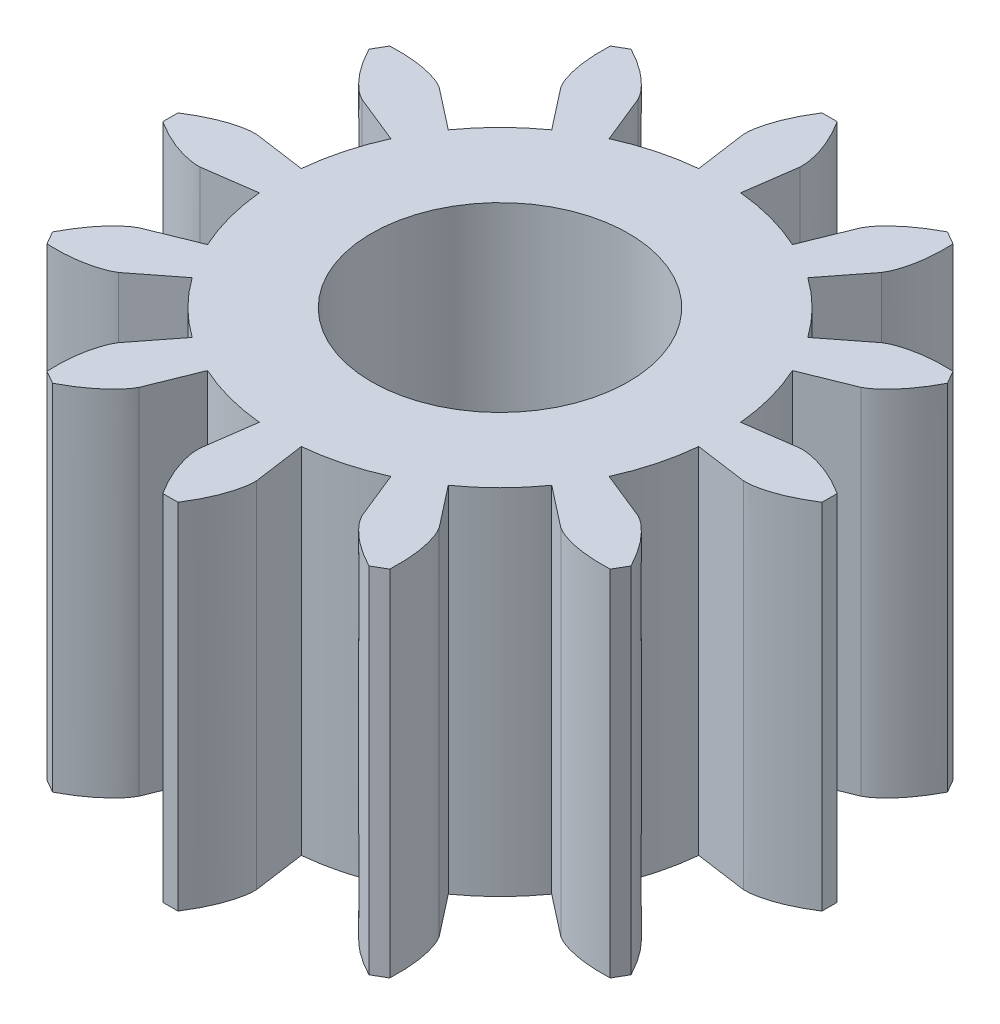
from build123d import *

# Parameters (mm, degrees)
BOSS_EXTRUDE1_DEPTH     = 5
BOSS_EXTRUDE2_DEPTH     = 2.3
CUT_EXTRUDE1_DEPTH      = 13.294307967
CUT_EXTRUDE1_DEPTH_BACK = 13.294307967
SKETCH2_R               = 2.65


with BuildPart() as part:
    # Sketch1 → Boss-Extrude1 (new body)
    with BuildSketch(Plane.XZ.offset(5)):
        with BuildLine():
            Line((3.744124802, -2.923017186), (4.444201828, -3.469563385))
            add(Edge.make_bspline(
                [(4.444201828, -3.469563385), (4.960450288, -3.799470899), (5.92556066, -3.726624593)],
                knots=[3.673021655, 3.673021655, 3.673021655, 4.715634663, 4.715634663, 4.715634663], degree=2, weights=[1, 0.867169263, 1]))
            Line((5.92556066, -3.726624593), (6.190131898, -3.268373767))
            add(Edge.make_bspline(
                [(6.190131898, -3.268373767), (5.77062665, -2.395142555), (5.226830946, -2.11400999)],
                knots=[1.547057367, 1.547057367, 1.547057367, 2.608226651, 2.608226651, 2.608226651], degree=2, weights=[1, 0.862511367, 1]))
            Line((5.226830946, -2.11400999), (4.40346954, -1.7809986))
            ThreePointArc((4.40346954, -1.7809986), (4.588147675, -1.229390464), (4.704015786, -0.659344738))
            Line((4.704015786, -0.659344738), (5.583573376, -0.782629118))
            add(Edge.make_bspline(
                [(5.583573376, -0.782629118), (6.195611413, -0.810213176), (6.99499836, -0.264571238)],
                knots=[3.673021655, 3.673021655, 3.673021655, 4.715634663, 4.715634663, 4.715634663], degree=2, weights=[1, 0.867169263, 1]))
            Line((6.99499836, -0.264571238), (6.99499836, 0.264571238))
            add(Edge.make_bspline(
                [(6.99499836, 0.264571238), (6.195080552, 0.811059027), (5.583573376, 0.782629118)],
                knots=[1.547057367, 1.547057367, 1.547057367, 2.608226651, 2.608226651, 2.608226651], degree=2, weights=[1, 0.862511367, 1]))
            Line((5.583573376, 0.782629118), (4.704015786, 0.659344738))
            ThreePointArc((4.704015786, 0.659344738), (4.588147675, 1.229390464), (4.40346954, 1.7809986))
            Line((4.40346954, 1.7809986), (5.226830946, 2.11400999))
            add(Edge.make_bspline(
                [(5.226830946, 2.11400999), (5.770663464, 2.396140514), (6.190131898, 3.268373767)],
                knots=[0.531429001, 0.531429001, 0.531429001, 1.57404201, 1.57404201, 1.57404201], degree=2, weights=[1, 0.867169263, 1]))
            Line((6.190131898, 3.268373767), (5.92556066, 3.726624593))
            add(Edge.make_bspline(
                [(5.92556066, 3.726624593), (4.959567623, 3.799937997), (4.444201828, 3.469563385)],
                knots=[1.547057367, 1.547057367, 1.547057367, 2.608226651, 2.608226651, 2.608226651], degree=2, weights=[1, 0.862511367, 1]))
            Line((4.444201828, 3.469563385), (3.744124802, 2.923017186))
            ThreePointArc((3.744124802, 2.923017186), (3.358757211, 3.358757211), (2.923017186, 3.744124802))
            Line((2.923017186, 3.744124802), (3.469563385, 4.444201828))
            add(Edge.make_bspline(
                [(3.469563385, 4.444201828), (3.799470899, 4.960450288), (3.726624593, 5.92556066)],
                knots=[0.531429001, 0.531429001, 0.531429001, 1.57404201, 1.57404201, 1.57404201], degree=2, weights=[1, 0.867169263, 1]))
            Line((3.726624593, 5.92556066), (3.268373767, 6.190131898))
            add(Edge.make_bspline(
                [(3.268373767, 6.190131898), (2.395142555, 5.77062665), (2.11400999, 5.226830946)],
                knots=[1.547057367, 1.547057367, 1.547057367, 2.608226651, 2.608226651, 2.608226651], degree=2, weights=[1, 0.862511367, 1]))
            Line((2.11400999, 5.226830946), (1.7809986, 4.40346954))
            ThreePointArc((1.7809986, 4.40346954), (1.229390464, 4.588147675), (0.659344738, 4.704015786))
            Line((0.659344738, 4.704015786), (0.782629118, 5.583573376))
            add(Edge.make_bspline(
                [(0.782629118, 5.583573376), (0.810213176, 6.195611413), (0.264571238, 6.99499836)],
                knots=[0.531429001, 0.531429001, 0.531429001, 1.57404201, 1.57404201, 1.57404201], degree=2, weights=[1, 0.867169263, 1]))
            Line((0.264571238, 6.99499836), (-0.264571238, 6.99499836))
            add(Edge.make_bspline(
                [(-0.264571238, 6.99499836), (-0.811059027, 6.195080552), (-0.782629118, 5.583573376)],
                knots=[4.688650021, 4.688650021, 4.688650021, 5.749819305, 5.749819305, 5.749819305], degree=2, weights=[1, 0.862511367, 1]))
            Line((-0.782629118, 5.583573376), (-0.659344738, 4.704015786))
            ThreePointArc((-0.659344738, 4.704015786), (-1.229390464, 4.588147675), (-1.7809986, 4.40346954))
            Line((-1.7809986, 4.40346954), (-2.11400999, 5.226830946))
            add(Edge.make_bspline(
                [(-2.11400999, 5.226830946), (-2.396140514, 5.770663464), (-3.268373767, 6.190131898)],
                knots=[0.531429001, 0.531429001, 0.531429001, 1.57404201, 1.57404201, 1.57404201], degree=2, weights=[1, 0.867169263, 1]))
            Line((-3.268373767, 6.190131898), (-3.726624593, 5.92556066))
            add(Edge.make_bspline(
                [(-3.726624593, 5.92556066), (-3.799937997, 4.959567623), (-3.469563385, 4.444201828)],
                knots=[4.688650021, 4.688650021, 4.688650021, 5.749819305, 5.749819305, 5.749819305], degree=2, weights=[1, 0.862511367, 1]))
            Line((-3.469563385, 4.444201828), (-2.923017186, 3.744124802))
            ThreePointArc((-2.923017186, 3.744124802), (-3.358757211, 3.358757211), (-3.744124802, 2.923017186))
            Line((-3.744124802, 2.923017186), (-4.444201828, 3.469563385))
            add(Edge.make_bspline(
                [(-4.444201828, 3.469563385), (-4.960450288, 3.799470899), (-5.92556066, 3.726624593)],
                knots=[0.531429001, 0.531429001, 0.531429001, 1.57404201, 1.57404201, 1.57404201], degree=2, weights=[1, 0.867169263, 1]))
            Line((-5.92556066, 3.726624593), (-6.190131898, 3.268373767))
            add(Edge.make_bspline(
                [(-6.190131898, 3.268373767), (-5.77062665, 2.395142555), (-5.226830946, 2.11400999)],
                knots=[4.688650021, 4.688650021, 4.688650021, 5.749819305, 5.749819305, 5.749819305], degree=2, weights=[1, 0.862511367, 1]))
            Line((-5.226830946, 2.11400999), (-4.40346954, 1.7809986))
            ThreePointArc((-4.40346954, 1.7809986), (-4.588147675, 1.229390464), (-4.704015786, 0.659344738))
            Line((-4.704015786, 0.659344738), (-5.583573376, 0.782629118))
            add(Edge.make_bspline(
                [(-5.583573376, 0.782629118), (-6.195611413, 0.810213176), (-6.99499836, 0.264571238)],
                knots=[0.531429001, 0.531429001, 0.531429001, 1.57404201, 1.57404201, 1.57404201], degree=2, weights=[1, 0.867169263, 1]))
            Line((-6.99499836, 0.264571238), (-6.99499836, -0.264571238))
            add(Edge.make_bspline(
                [(-6.99499836, -0.264571238), (-6.195080552, -0.811059027), (-5.583573376, -0.782629118)],
                knots=[4.688650021, 4.688650021, 4.688650021, 5.749819305, 5.749819305, 5.749819305], degree=2, weights=[1, 0.862511367, 1]))
            Line((-5.583573376, -0.782629118), (-4.704015786, -0.659344738))
            ThreePointArc((-4.704015786, -0.659344738), (-4.588147675, -1.229390464), (-4.40346954, -1.7809986))
            Line((-4.40346954, -1.7809986), (-5.226830946, -2.11400999))
            add(Edge.make_bspline(
                [(-5.226830946, -2.11400999), (-5.770663464, -2.396140514), (-6.190131898, -3.268373767)],
                knots=[3.673021655, 3.673021655, 3.673021655, 4.715634663, 4.715634663, 4.715634663], degree=2, weights=[1, 0.867169263, 1]))
            Line((-6.190131898, -3.268373767), (-5.92556066, -3.726624593))
            add(Edge.make_bspline(
                [(-5.92556066, -3.726624593), (-4.959567623, -3.799937997), (-4.444201828, -3.469563385)],
                knots=[4.688650021, 4.688650021, 4.688650021, 5.749819305, 5.749819305, 5.749819305], degree=2, weights=[1, 0.862511367, 1]))
            Line((-4.444201828, -3.469563385), (-3.744124802, -2.923017186))
            ThreePointArc((-3.744124802, -2.923017186), (-3.358757211, -3.358757211), (-2.923017186, -3.744124802))
            Line((-2.923017186, -3.744124802), (-3.469563385, -4.444201828))
            add(Edge.make_bspline(
                [(-3.469563385, -4.444201828), (-3.799470899, -4.960450288), (-3.726624593, -5.92556066)],
                knots=[3.673021655, 3.673021655, 3.673021655, 4.715634663, 4.715634663, 4.715634663], degree=2, weights=[1, 0.867169263, 1]))
            Line((-3.726624593, -5.92556066), (-3.268373767, -6.190131898))
            add(Edge.make_bspline(
                [(-3.268373767, -6.190131898), (-2.395142555, -5.77062665), (-2.11400999, -5.226830946)],
                knots=[1.547057367, 1.547057367, 1.547057367, 2.608226651, 2.608226651, 2.608226651], degree=2, weights=[1, 0.862511367, 1]))
            Line((-2.11400999, -5.226830946), (-1.7809986, -4.40346954))
            ThreePointArc((-1.7809986, -4.40346954), (-1.229390464, -4.588147675), (-0.659344738, -4.704015786))
            Line((-0.659344738, -4.704015786), (-0.782629118, -5.583573376))
            add(Edge.make_bspline(
                [(-0.782629118, -5.583573376), (-0.810213176, -6.195611413), (-0.264571238, -6.99499836)],
                knots=[3.673021655, 3.673021655, 3.673021655, 4.715634663, 4.715634663, 4.715634663], degree=2, weights=[1, 0.867169263, 1]))
            Line((-0.264571238, -6.99499836), (0.264571238, -6.99499836))
            add(Edge.make_bspline(
                [(0.264571238, -6.99499836), (0.811059027, -6.195080552), (0.782629118, -5.583573376)],
                knots=[1.547057367, 1.547057367, 1.547057367, 2.608226651, 2.608226651, 2.608226651], degree=2, weights=[1, 0.862511367, 1]))
            Line((0.782629118, -5.583573376), (0.659344738, -4.704015786))
            ThreePointArc((0.659344738, -4.704015786), (1.229390464, -4.588147675), (1.7809986, -4.40346954))
            Line((1.7809986, -4.40346954), (2.11400999, -5.226830946))
            add(Edge.make_bspline(
                [(2.11400999, -5.226830946), (2.396140514, -5.770663464), (3.268373767, -6.190131898)],
                knots=[3.673021655, 3.673021655, 3.673021655, 4.715634663, 4.715634663, 4.715634663], degree=2, weights=[1, 0.867169263, 1]))
            Line((3.268373767, -6.190131898), (3.726624593, -5.92556066))
            add(Edge.make_bspline(
                [(3.726624593, -5.92556066), (3.799937997, -4.959567623), (3.469563385, -4.444201828)],
                knots=[1.547057367, 1.547057367, 1.547057367, 2.608226651, 2.608226651, 2.608226651], degree=2, weights=[1, 0.862511367, 1]))
            Line((3.469563385, -4.444201828), (2.923017186, -3.744124802))
            ThreePointArc((2.923017186, -3.744124802), (3.358757211, -3.358757211), (3.744124802, -2.923017186))
        make_face()
    extrude(amount=-BOSS_EXTRUDE1_DEPTH)

    # Sketch3 → Boss-Extrude2 (add)
    with BuildSketch(Plane(origin=(0, 0, 0), x_dir=(1, 0, 0), z_dir=(0, 1, 0))):
        with BuildLine():
            Line((2.923017186, 3.744124802), (3.469563385, 4.444201828))
            add(Edge.make_bspline(
                [(3.469563385, 4.444201828), (3.799937997, 4.959567623), (3.726624593, 5.92556066)],
                knots=[3.674958656, 3.674958656, 3.674958656, 4.73612794, 4.73612794, 4.73612794], degree=2, weights=[1, 0.862511367, 1]))
            Line((3.726624593, 5.92556066), (3.268373767, 6.190131898))
            add(Edge.make_bspline(
                [(3.268373767, 6.190131898), (2.396140514, 5.770663464), (2.11400999, 5.226830946)],
                knots=[1.567550644, 1.567550644, 1.567550644, 2.610163652, 2.610163652, 2.610163652], degree=2, weights=[1, 0.867169263, 1]))
            Line((2.11400999, 5.226830946), (1.7809986, 4.40346954))
            ThreePointArc((1.7809986, 4.40346954), (1.229390464, 4.588147675), (0.659344738, 4.704015786))
            Line((0.659344738, 4.704015786), (0.782629118, 5.583573376))
            add(Edge.make_bspline(
                [(0.782629118, 5.583573376), (0.811059027, 6.195080552), (0.264571238, 6.99499836)],
                knots=[3.674958656, 3.674958656, 3.674958656, 4.73612794, 4.73612794, 4.73612794], degree=2, weights=[1, 0.862511367, 1]))
            Line((0.264571238, 6.99499836), (-0.264571238, 6.99499836))
            add(Edge.make_bspline(
                [(-0.264571238, 6.99499836), (-0.810213176, 6.195611413), (-0.782629118, 5.583573376)],
                knots=[1.567550644, 1.567550644, 1.567550644, 2.610163652, 2.610163652, 2.610163652], degree=2, weights=[1, 0.867169263, 1]))
            Line((-0.782629118, 5.583573376), (-0.659344738, 4.704015786))
            ThreePointArc((-0.659344738, 4.704015786), (-1.229390464, 4.588147675), (-1.7809986, 4.40346954))
            Line((-1.7809986, 4.40346954), (-2.11400999, 5.226830946))
            add(Edge.make_bspline(
                [(-2.11400999, 5.226830946), (-2.395142555, 5.77062665), (-3.268373767, 6.190131898)],
                knots=[0.533366002, 0.533366002, 0.533366002, 1.594535286, 1.594535286, 1.594535286], degree=2, weights=[1, 0.862511367, 1]))
            Line((-3.268373767, 6.190131898), (-3.726624593, 5.92556066))
            add(Edge.make_bspline(
                [(-3.726624593, 5.92556066), (-3.799470899, 4.960450288), (-3.469563385, 4.444201828)],
                knots=[1.567550644, 1.567550644, 1.567550644, 2.610163652, 2.610163652, 2.610163652], degree=2, weights=[1, 0.867169263, 1]))
            Line((-3.469563385, 4.444201828), (-2.923017186, 3.744124802))
            ThreePointArc((-2.923017186, 3.744124802), (-3.358757211, 3.358757211), (-3.744124802, 2.923017186))
            Line((-3.744124802, 2.923017186), (-4.444201828, 3.469563385))
            add(Edge.make_bspline(
                [(-4.444201828, 3.469563385), (-4.959567623, 3.799937997), (-5.92556066, 3.726624593)],
                knots=[0.533366002, 0.533366002, 0.533366002, 1.594535286, 1.594535286, 1.594535286], degree=2, weights=[1, 0.862511367, 1]))
            Line((-5.92556066, 3.726624593), (-6.190131898, 3.268373767))
            add(Edge.make_bspline(
                [(-6.190131898, 3.268373767), (-5.770663464, 2.396140514), (-5.226830946, 2.11400999)],
                knots=[1.567550644, 1.567550644, 1.567550644, 2.610163652, 2.610163652, 2.610163652], degree=2, weights=[1, 0.867169263, 1]))
            Line((-5.226830946, 2.11400999), (-4.40346954, 1.7809986))
            ThreePointArc((-4.40346954, 1.7809986), (-4.588147675, 1.229390464), (-4.704015786, 0.659344738))
            Line((-4.704015786, 0.659344738), (-5.583573376, 0.782629118))
            add(Edge.make_bspline(
                [(-5.583573376, 0.782629118), (-6.195080552, 0.811059027), (-6.99499836, 0.264571238)],
                knots=[0.533366002, 0.533366002, 0.533366002, 1.594535286, 1.594535286, 1.594535286], degree=2, weights=[1, 0.862511367, 1]))
            Line((-6.99499836, 0.264571238), (-6.99499836, -0.264571238))
            add(Edge.make_bspline(
                [(-6.99499836, -0.264571238), (-6.195611413, -0.810213176), (-5.583573376, -0.782629118)],
                knots=[1.567550644, 1.567550644, 1.567550644, 2.610163652, 2.610163652, 2.610163652], degree=2, weights=[1, 0.867169263, 1]))
            Line((-5.583573376, -0.782629118), (-4.704015786, -0.659344738))
            ThreePointArc((-4.704015786, -0.659344738), (-4.588147675, -1.229390464), (-4.40346954, -1.7809986))
            Line((-4.40346954, -1.7809986), (-5.226830946, -2.11400999))
            add(Edge.make_bspline(
                [(-5.226830946, -2.11400999), (-5.77062665, -2.395142555), (-6.190131898, -3.268373767)],
                knots=[3.674958656, 3.674958656, 3.674958656, 4.73612794, 4.73612794, 4.73612794], degree=2, weights=[1, 0.862511367, 1]))
            Line((-6.190131898, -3.268373767), (-5.92556066, -3.726624593))
            add(Edge.make_bspline(
                [(-5.92556066, -3.726624593), (-4.960450288, -3.799470899), (-4.444201828, -3.469563385)],
                knots=[4.709143297, 4.709143297, 4.709143297, 5.751756306, 5.751756306, 5.751756306], degree=2, weights=[1, 0.867169263, 1]))
            Line((-4.444201828, -3.469563385), (-3.744124802, -2.923017186))
            ThreePointArc((-3.744124802, -2.923017186), (-3.358757211, -3.358757211), (-2.923017186, -3.744124802))
            Line((-2.923017186, -3.744124802), (-3.469563385, -4.444201828))
            add(Edge.make_bspline(
                [(-3.469563385, -4.444201828), (-3.799937997, -4.959567623), (-3.726624593, -5.92556066)],
                knots=[0.533366002, 0.533366002, 0.533366002, 1.594535286, 1.594535286, 1.594535286], degree=2, weights=[1, 0.862511367, 1]))
            Line((-3.726624593, -5.92556066), (-3.268373767, -6.190131898))
            add(Edge.make_bspline(
                [(-3.268373767, -6.190131898), (-2.396140514, -5.770663464), (-2.11400999, -5.226830946)],
                knots=[1.567550644, 1.567550644, 1.567550644, 2.610163652, 2.610163652, 2.610163652], degree=2, weights=[1, 0.867169263, 1]))
            Line((-2.11400999, -5.226830946), (-1.7809986, -4.40346954))
            ThreePointArc((-1.7809986, -4.40346954), (-1.229390464, -4.588147675), (-0.659344738, -4.704015786))
            Line((-0.659344738, -4.704015786), (-0.782629118, -5.583573376))
            add(Edge.make_bspline(
                [(-0.782629118, -5.583573376), (-0.811059027, -6.195080552), (-0.264571238, -6.99499836)],
                knots=[0.533366002, 0.533366002, 0.533366002, 1.594535286, 1.594535286, 1.594535286], degree=2, weights=[1, 0.862511367, 1]))
            Line((-0.264571238, -6.99499836), (0.264571238, -6.99499836))
            add(Edge.make_bspline(
                [(0.264571238, -6.99499836), (0.810213176, -6.195611413), (0.782629118, -5.583573376)],
                knots=[4.709143297, 4.709143297, 4.709143297, 5.751756306, 5.751756306, 5.751756306], degree=2, weights=[1, 0.867169263, 1]))
            Line((0.782629118, -5.583573376), (0.659344738, -4.704015786))
            ThreePointArc((0.659344738, -4.704015786), (1.229390464, -4.588147675), (1.7809986, -4.40346954))
            Line((1.7809986, -4.40346954), (2.11400999, -5.226830946))
            add(Edge.make_bspline(
                [(2.11400999, -5.226830946), (2.395142555, -5.77062665), (3.268373767, -6.190131898)],
                knots=[3.674958656, 3.674958656, 3.674958656, 4.73612794, 4.73612794, 4.73612794], degree=2, weights=[1, 0.862511367, 1]))
            Line((3.268373767, -6.190131898), (3.726624593, -5.92556066))
            add(Edge.make_bspline(
                [(3.726624593, -5.92556066), (3.799470899, -4.960450288), (3.469563385, -4.444201828)],
                knots=[4.709143297, 4.709143297, 4.709143297, 5.751756306, 5.751756306, 5.751756306], degree=2, weights=[1, 0.867169263, 1]))
            Line((3.469563385, -4.444201828), (2.923017186, -3.744124802))
            ThreePointArc((2.923017186, -3.744124802), (3.358757211, -3.358757211), (3.744124802, -2.923017186))
            Line((3.744124802, -2.923017186), (4.444201828, -3.469563385))
            add(Edge.make_bspline(
                [(4.444201828, -3.469563385), (4.959567623, -3.799937997), (5.92556066, -3.726624593)],
                knots=[3.674958656, 3.674958656, 3.674958656, 4.73612794, 4.73612794, 4.73612794], degree=2, weights=[1, 0.862511367, 1]))
            Line((5.92556066, -3.726624593), (6.190131898, -3.268373767))
            add(Edge.make_bspline(
                [(6.190131898, -3.268373767), (5.770663464, -2.396140514), (5.226830946, -2.11400999)],
                knots=[4.709143297, 4.709143297, 4.709143297, 5.751756306, 5.751756306, 5.751756306], degree=2, weights=[1, 0.867169263, 1]))
            Line((5.226830946, -2.11400999), (4.40346954, -1.7809986))
            ThreePointArc((4.40346954, -1.7809986), (4.588147675, -1.229390464), (4.704015786, -0.659344738))
            Line((4.704015786, -0.659344738), (5.583573376, -0.782629118))
            add(Edge.make_bspline(
                [(5.583573376, -0.782629118), (6.195080552, -0.811059027), (6.99499836, -0.264571238)],
                knots=[3.674958656, 3.674958656, 3.674958656, 4.73612794, 4.73612794, 4.73612794], degree=2, weights=[1, 0.862511367, 1]))
            Line((6.99499836, -0.264571238), (6.99499836, 0.264571238))
            add(Edge.make_bspline(
                [(6.99499836, 0.264571238), (6.195611413, 0.810213176), (5.583573376, 0.782629118)],
                knots=[1.567550644, 1.567550644, 1.567550644, 2.610163652, 2.610163652, 2.610163652], degree=2, weights=[1, 0.867169263, 1]))
            Line((5.583573376, 0.782629118), (4.704015786, 0.659344738))
            ThreePointArc((4.704015786, 0.659344738), (4.588147675, 1.229390464), (4.40346954, 1.7809986))
            Line((4.40346954, 1.7809986), (5.226830946, 2.11400999))
            add(Edge.make_bspline(
                [(5.226830946, 2.11400999), (5.77062665, 2.395142555), (6.190131898, 3.268373767)],
                knots=[3.674958656, 3.674958656, 3.674958656, 4.73612794, 4.73612794, 4.73612794], degree=2, weights=[1, 0.862511367, 1]))
            Line((6.190131898, 3.268373767), (5.92556066, 3.726624593))
            add(Edge.make_bspline(
                [(5.92556066, 3.726624593), (4.960450288, 3.799470899), (4.444201828, 3.469563385)],
                knots=[1.567550644, 1.567550644, 1.567550644, 2.610163652, 2.610163652, 2.610163652], degree=2, weights=[1, 0.867169263, 1]))
            Line((4.444201828, 3.469563385), (3.744124802, 2.923017186))
            ThreePointArc((3.744124802, 2.923017186), (3.358757211, 3.358757211), (2.923017186, 3.744124802))
        make_face()
    extrude(amount=BOSS_EXTRUDE2_DEPTH)

    # Sketch2 → Cut-Extrude1 (cut, two sides: drawn at the far end of the back side and taken through both)
    # profile 1 of 2: a face of its own
    with BuildSketch(Plane(origin=(0, -5, 0), x_dir=(1, 0, 0), z_dir=(0, 1, 0)).offset(-CUT_EXTRUDE1_DEPTH_BACK)):
        with BuildLine():
            ThreePointArc((3.744124802, 2.923017186), (3.358757211, 3.358757211), (2.923017186, 3.744124802))
            Line((2.923017186, 3.744124802), (3.469563385, 4.444201828))
            add(Edge.make_bspline(
                [(3.469563385, 4.444201828), (3.799937997, 4.959567623), (3.726624593, 5.92556066)],
                knots=[3.674958656, 3.674958656, 3.674958656, 4.73612794, 4.73612794, 4.73612794], degree=2, weights=[1, 0.862511367, 1]))
            Line((3.726624593, 5.92556066), (3.268373767, 6.190131898))
            add(Edge.make_bspline(
                [(3.268373767, 6.190131898), (2.396140514, 5.770663464), (2.11400999, 5.226830946)],
                knots=[4.709143297, 4.709143297, 4.709143297, 5.751756306, 5.751756306, 5.751756306], degree=2, weights=[1, 0.867169263, 1]))
            Line((2.11400999, 5.226830946), (1.7809986, 4.40346954))
            ThreePointArc((1.7809986, 4.40346954), (1.229390464, 4.588147675), (0.659344738, 4.704015786))
            Line((0.659344738, 4.704015786), (0.782629118, 5.583573376))
            add(Edge.make_bspline(
                [(0.782629118, 5.583573376), (0.811059027, 6.195080552), (0.264571238, 6.99499836)],
                knots=[3.674958656, 3.674958656, 3.674958656, 4.73612794, 4.73612794, 4.73612794], degree=2, weights=[1, 0.862511367, 1]))
            Line((0.264571238, 6.99499836), (-0.264571238, 6.99499836))
            add(Edge.make_bspline(
                [(-0.264571238, 6.99499836), (-0.810213176, 6.195611413), (-0.782629118, 5.583573376)],
                knots=[1.567550644, 1.567550644, 1.567550644, 2.610163652, 2.610163652, 2.610163652], degree=2, weights=[1, 0.867169263, 1]))
            Line((-0.782629118, 5.583573376), (-0.659344738, 4.704015786))
            ThreePointArc((-0.659344738, 4.704015786), (-1.229390464, 4.588147675), (-1.7809986, 4.40346954))
            Line((-1.7809986, 4.40346954), (-2.11400999, 5.226830946))
            add(Edge.make_bspline(
                [(-2.11400999, 5.226830946), (-2.395142555, 5.77062665), (-3.268373767, 6.190131898)],
                knots=[0.533366002, 0.533366002, 0.533366002, 1.594535286, 1.594535286, 1.594535286], degree=2, weights=[1, 0.862511367, 1]))
            Line((-3.268373767, 6.190131898), (-3.726624593, 5.92556066))
            add(Edge.make_bspline(
                [(-3.726624593, 5.92556066), (-3.799470899, 4.960450288), (-3.469563385, 4.444201828)],
                knots=[1.567550644, 1.567550644, 1.567550644, 2.610163652, 2.610163652, 2.610163652], degree=2, weights=[1, 0.867169263, 1]))
            Line((-3.469563385, 4.444201828), (-2.923017186, 3.744124802))
            ThreePointArc((-2.923017186, 3.744124802), (-3.358757211, 3.358757211), (-3.744124802, 2.923017186))
            Line((-3.744124802, 2.923017186), (-4.444201828, 3.469563385))
            add(Edge.make_bspline(
                [(-4.444201828, 3.469563385), (-4.959567623, 3.799937997), (-5.92556066, 3.726624593)],
                knots=[0.533366002, 0.533366002, 0.533366002, 1.594535286, 1.594535286, 1.594535286], degree=2, weights=[1, 0.862511367, 1]))
            Line((-5.92556066, 3.726624593), (-6.190131898, 3.268373767))
            add(Edge.make_bspline(
                [(-6.190131898, 3.268373767), (-5.770663464, 2.396140514), (-5.226830946, 2.11400999)],
                knots=[1.567550644, 1.567550644, 1.567550644, 2.610163652, 2.610163652, 2.610163652], degree=2, weights=[1, 0.867169263, 1]))
            Line((-5.226830946, 2.11400999), (-4.40346954, 1.7809986))
            ThreePointArc((-4.40346954, 1.7809986), (-4.588147675, 1.229390464), (-4.704015786, 0.659344738))
            Line((-4.704015786, 0.659344738), (-5.583573376, 0.782629118))
            add(Edge.make_bspline(
                [(-5.583573376, 0.782629118), (-6.195080552, 0.811059027), (-6.99499836, 0.264571238)],
                knots=[0.533366002, 0.533366002, 0.533366002, 1.594535286, 1.594535286, 1.594535286], degree=2, weights=[1, 0.862511367, 1]))
            Line((-6.99499836, 0.264571238), (-6.99499836, -0.264571238))
            add(Edge.make_bspline(
                [(-6.99499836, -0.264571238), (-6.195611413, -0.810213176), (-5.583573376, -0.782629118)],
                knots=[1.567550644, 1.567550644, 1.567550644, 2.610163652, 2.610163652, 2.610163652], degree=2, weights=[1, 0.867169263, 1]))
            Line((-5.583573376, -0.782629118), (-4.704015786, -0.659344738))
            ThreePointArc((-4.704015786, -0.659344738), (-4.588147675, -1.229390464), (-4.40346954, -1.7809986))
            Line((-4.40346954, -1.7809986), (-5.226830946, -2.11400999))
            add(Edge.make_bspline(
                [(-5.226830946, -2.11400999), (-5.77062665, -2.395142555), (-6.190131898, -3.268373767)],
                knots=[3.674958656, 3.674958656, 3.674958656, 4.73612794, 4.73612794, 4.73612794], degree=2, weights=[1, 0.862511367, 1]))
            Line((-6.190131898, -3.268373767), (-5.92556066, -3.726624593))
            add(Edge.make_bspline(
                [(-5.92556066, -3.726624593), (-4.960450288, -3.799470899), (-4.444201828, -3.469563385)],
                knots=[4.709143297, 4.709143297, 4.709143297, 5.751756306, 5.751756306, 5.751756306], degree=2, weights=[1, 0.867169263, 1]))
            Line((-4.444201828, -3.469563385), (-3.744124802, -2.923017186))
            ThreePointArc((-3.744124802, -2.923017186), (-3.358757211, -3.358757211), (-2.923017186, -3.744124802))
            Line((-2.923017186, -3.744124802), (-3.469563385, -4.444201828))
            add(Edge.make_bspline(
                [(-3.469563385, -4.444201828), (-3.799937997, -4.959567623), (-3.726624593, -5.92556066)],
                knots=[0.533366002, 0.533366002, 0.533366002, 1.594535286, 1.594535286, 1.594535286], degree=2, weights=[1, 0.862511367, 1]))
            Line((-3.726624593, -5.92556066), (-3.268373767, -6.190131898))
            add(Edge.make_bspline(
                [(-3.268373767, -6.190131898), (-2.396140514, -5.770663464), (-2.11400999, -5.226830946)],
                knots=[4.709143297, 4.709143297, 4.709143297, 5.751756306, 5.751756306, 5.751756306], degree=2, weights=[1, 0.867169263, 1]))
            Line((-2.11400999, -5.226830946), (-1.7809986, -4.40346954))
            ThreePointArc((-1.7809986, -4.40346954), (-1.229390464, -4.588147675), (-0.659344738, -4.704015786))
            Line((-0.659344738, -4.704015786), (-0.782629118, -5.583573376))
            add(Edge.make_bspline(
                [(-0.782629118, -5.583573376), (-0.811059027, -6.195080552), (-0.264571238, -6.99499836)],
                knots=[0.533366002, 0.533366002, 0.533366002, 1.594535286, 1.594535286, 1.594535286], degree=2, weights=[1, 0.862511367, 1]))
            Line((-0.264571238, -6.99499836), (0.264571238, -6.99499836))
            add(Edge.make_bspline(
                [(0.264571238, -6.99499836), (0.810213176, -6.195611413), (0.782629118, -5.583573376)],
                knots=[4.709143297, 4.709143297, 4.709143297, 5.751756306, 5.751756306, 5.751756306], degree=2, weights=[1, 0.867169263, 1]))
            Line((0.782629118, -5.583573376), (0.659344738, -4.704015786))
            ThreePointArc((0.659344738, -4.704015786), (1.229390464, -4.588147675), (1.7809986, -4.40346954))
            Line((1.7809986, -4.40346954), (2.11400999, -5.226830946))
            add(Edge.make_bspline(
                [(2.11400999, -5.226830946), (2.395142555, -5.77062665), (3.268373767, -6.190131898)],
                knots=[3.674958656, 3.674958656, 3.674958656, 4.73612794, 4.73612794, 4.73612794], degree=2, weights=[1, 0.862511367, 1]))
            Line((3.268373767, -6.190131898), (3.726624593, -5.92556066))
            add(Edge.make_bspline(
                [(3.726624593, -5.92556066), (3.799470899, -4.960450288), (3.469563385, -4.444201828)],
                knots=[4.709143297, 4.709143297, 4.709143297, 5.751756306, 5.751756306, 5.751756306], degree=2, weights=[1, 0.867169263, 1]))
            Line((3.469563385, -4.444201828), (2.923017186, -3.744124802))
            ThreePointArc((2.923017186, -3.744124802), (3.358757211, -3.358757211), (3.744124802, -2.923017186))
            Line((3.744124802, -2.923017186), (4.444201828, -3.469563385))
            add(Edge.make_bspline(
                [(4.444201828, -3.469563385), (4.959567623, -3.799937997), (5.92556066, -3.726624593)],
                knots=[3.674958656, 3.674958656, 3.674958656, 4.73612794, 4.73612794, 4.73612794], degree=2, weights=[1, 0.862511367, 1]))
            Line((5.92556066, -3.726624593), (6.190131898, -3.268373767))
            add(Edge.make_bspline(
                [(6.190131898, -3.268373767), (5.770663464, -2.396140514), (5.226830946, -2.11400999)],
                knots=[4.709143297, 4.709143297, 4.709143297, 5.751756306, 5.751756306, 5.751756306], degree=2, weights=[1, 0.867169263, 1]))
            Line((5.226830946, -2.11400999), (4.40346954, -1.7809986))
            ThreePointArc((4.40346954, -1.7809986), (4.588147675, -1.229390464), (4.704015786, -0.659344738))
            Line((4.704015786, -0.659344738), (5.583573376, -0.782629118))
            add(Edge.make_bspline(
                [(5.583573376, -0.782629118), (6.195080552, -0.811059027), (6.99499836, -0.264571238)],
                knots=[3.674958656, 3.674958656, 3.674958656, 4.73612794, 4.73612794, 4.73612794], degree=2, weights=[1, 0.862511367, 1]))
            Line((6.99499836, -0.264571238), (6.99499836, 0.264571238))
            add(Edge.make_bspline(
                [(6.99499836, 0.264571238), (6.195611413, 0.810213176), (5.583573376, 0.782629118)],
                knots=[1.567550644, 1.567550644, 1.567550644, 2.610163652, 2.610163652, 2.610163652], degree=2, weights=[1, 0.867169263, 1]))
            Line((5.583573376, 0.782629118), (4.704015786, 0.659344738))
            ThreePointArc((4.704015786, 0.659344738), (4.588147675, 1.229390464), (4.40346954, 1.7809986))
            Line((4.40346954, 1.7809986), (5.226830946, 2.11400999))
            add(Edge.make_bspline(
                [(5.226830946, 2.11400999), (5.77062665, 2.395142555), (6.190131898, 3.268373767)],
                knots=[3.674958656, 3.674958656, 3.674958656, 4.73612794, 4.73612794, 4.73612794], degree=2, weights=[1, 0.862511367, 1]))
            Line((6.190131898, 3.268373767), (5.92556066, 3.726624593))
            add(Edge.make_bspline(
                [(5.92556066, 3.726624593), (4.960450288, 3.799470899), (4.444201828, 3.469563385)],
                knots=[1.567550644, 1.567550644, 1.567550644, 2.610163652, 2.610163652, 2.610163652], degree=2, weights=[1, 0.867169263, 1]))
            Line((4.444201828, 3.469563385), (3.744124802, 2.923017186))
        make_face()
        with BuildLine():
            Line((0.583201283, 5.601603877), (0.432908585, 4.529358692))
            ThreePointArc((0.432908585, 4.529358692), (1.177626655, 4.39496251), (1.889769513, 4.138993982))
            Line((1.889769513, 4.138993982), (2.29568192, 5.142601127))
            add(Edge.make_bspline(
                [(3.261437591, 5.963196394), (3.149246973, 5.905197908), (2.926035633, 5.774004944), (2.643276304, 5.56128076), (2.419399223, 5.335153931), (2.333947743, 5.214361108), (2.29568192, 5.142601127)],
                knots=[1.633086363, 1.633086363, 1.633086363, 1.633086363, 1.874752515, 2.116418667, 2.358084819, 2.599750971, 2.599750971, 2.599750971, 2.599750971], degree=3))
            Line((3.261437591, 5.963196394), (3.533592046, 5.806067946))
            add(Edge.make_bspline(
                [(3.305869065, 4.559530618), (3.348835749, 4.628263389), (3.410380503, 4.761897927), (3.49450127, 5.06942705), (3.537433003, 5.421416323), (3.539475844, 5.679976176), (3.533592046, 5.806067946)],
                knots=[-2.597711525, -2.597711525, -2.597711525, -2.597711525, -2.3517594, -2.105807275, -1.85985515, -1.613903025, -1.613903025, -1.613903025, -1.613903025], degree=3))
            Line((3.305869065, 4.559530618), (2.639589178, 3.706085397))
            ThreePointArc((2.639589178, 3.706085397), (3.217335854, 3.217335854), (3.706085397, 2.639589178))
            Line((3.706085397, 2.639589178), (4.559419426, 3.305782257))
            add(Edge.make_bspline(
                [(5.806086003, 3.533560769), (5.679926835, 3.539427917), (5.421023662, 3.537417147), (5.069784808, 3.494572264), (4.762838154, 3.410679226), (4.62843859, 3.348795312), (4.559419426, 3.305782257)],
                knots=[1.633086363, 1.633086363, 1.633086363, 1.633086363, 1.874752515, 2.116418667, 2.358084819, 2.599750971, 2.599750971, 2.599750971, 2.599750971], degree=3))
            Line((5.806086003, 3.533560769), (5.963214451, 3.261406314))
            add(Edge.make_bspline(
                [(5.142731901, 2.295734812), (5.214308526, 2.333775795), (5.334425116, 2.418734324), (5.561040399, 2.643001973), (5.774215007, 2.926367759), (5.905264085, 3.14926574), (5.963214451, 3.261406314)],
                knots=[-2.597711525, -2.597711525, -2.597711525, -2.597711525, -2.3517594, -2.105807275, -1.85985515, -1.613903025, -1.613903025, -1.613903025, -1.613903025], degree=3))
            Line((5.142731901, 2.295734812), (4.138993982, 1.889769513))
            ThreePointArc((4.138993982, 1.889769513), (4.39496251, 1.177626655), (4.529358692, 0.432908585))
            Line((4.529358692, 0.432908585), (5.601464178, 0.583181702))
            add(Edge.make_bspline(
                [(6.79499836, 0.15711039), (6.688674889, 0.225271073), (6.463452779, 0.352981282), (6.137848567, 0.491495952), (5.830078449, 0.572315777), (5.682743055, 0.585922517), (5.601464178, 0.583181702)],
                knots=[1.633086363, 1.633086363, 1.633086363, 1.633086363, 1.874752515, 2.116418667, 2.358084819, 2.599750971, 2.599750971, 2.599750971, 2.599750971], degree=3))
            Line((6.79499836, 0.15711039), (6.79499836, -0.157146505))
            add(Edge.make_bspline(
                [(5.601603877, -0.583201283), (5.682611544, -0.586045137), (5.829114826, -0.572527189), (6.137503243, -0.491613348), (6.463800762, -0.352798684), (6.688741584, -0.225287909), (6.79499836, -0.157146505)],
                knots=[-2.597711525, -2.597711525, -2.597711525, -2.597711525, -2.3517594, -2.105807275, -1.85985515, -1.613903025, -1.613903025, -1.613903025, -1.613903025], degree=3))
            Line((5.601603877, -0.583201283), (4.529358692, -0.432908585))
            ThreePointArc((4.529358692, -0.432908585), (4.39496251, -1.177626655), (4.138993982, -1.889769513))
            Line((4.138993982, -1.889769513), (5.142601127, -2.29568192))
            add(Edge.make_bspline(
                [(5.963196394, -3.261437591), (5.905197908, -3.149246973), (5.774004944, -2.926035633), (5.56128076, -2.643276304), (5.335153931, -2.419399223), (5.214361108, -2.333947743), (5.142601127, -2.29568192)],
                knots=[-1.508506291, -1.508506291, -1.508506291, -1.508506291, -1.266840139, -1.025173987, -0.783507835, -0.541841683, -0.541841683, -0.541841683, -0.541841683], degree=3))
            Line((5.963196394, -3.261437591), (5.806067946, -3.533592046))
            add(Edge.make_bspline(
                [(4.559530618, -3.305869065), (4.628263389, -3.348835749), (4.761897927, -3.410380503), (5.06942705, -3.49450127), (5.421416323, -3.537433003), (5.679976176, -3.539475844), (5.806067946, -3.533592046)],
                knots=[-2.597711525, -2.597711525, -2.597711525, -2.597711525, -2.3517594, -2.105807275, -1.85985515, -1.613903025, -1.613903025, -1.613903025, -1.613903025], degree=3))
            Line((4.559530618, -3.305869065), (3.706085397, -2.639589178))
            ThreePointArc((3.706085397, -2.639589178), (3.217335854, -3.217335854), (2.639589178, -3.706085397))
            Line((2.639589178, -3.706085397), (3.305782257, -4.559419426))
            add(Edge.make_bspline(
                [(3.533560769, -5.806086003), (3.539427917, -5.679926835), (3.537417147, -5.421023662), (3.494572264, -5.069784808), (3.410679226, -4.762838154), (3.348795312, -4.62843859), (3.305782257, -4.559419426)],
                knots=[-1.508506291, -1.508506291, -1.508506291, -1.508506291, -1.266840139, -1.025173987, -0.783507835, -0.541841683, -0.541841683, -0.541841683, -0.541841683], degree=3))
            Line((3.533560769, -5.806086003), (3.261406314, -5.963214451))
            add(Edge.make_bspline(
                [(2.295734812, -5.142731901), (2.333775795, -5.214308526), (2.418734324, -5.334425116), (2.643001973, -5.561040399), (2.926367759, -5.774215007), (3.14926574, -5.905264085), (3.261406314, -5.963214451)],
                knots=[-2.597711525, -2.597711525, -2.597711525, -2.597711525, -2.3517594, -2.105807275, -1.85985515, -1.613903025, -1.613903025, -1.613903025, -1.613903025], degree=3))
            Line((2.295734812, -5.142731901), (1.889769513, -4.138993982))
            ThreePointArc((1.889769513, -4.138993982), (1.177626655, -4.39496251), (0.432908585, -4.529358692))
            Line((0.432908585, -4.529358692), (0.583181702, -5.601464178))
            add(Edge.make_bspline(
                [(0.15711039, -6.79499836), (0.225271073, -6.688674889), (0.352981282, -6.463452779), (0.491495952, -6.137848567), (0.572315777, -5.830078449), (0.585922517, -5.682743055), (0.583181702, -5.601464178)],
                knots=[-1.508506291, -1.508506291, -1.508506291, -1.508506291, -1.266840139, -1.025173987, -0.783507835, -0.541841683, -0.541841683, -0.541841683, -0.541841683], degree=3))
            Line((0.15711039, -6.79499836), (-0.157146505, -6.79499836))
            add(Edge.make_bspline(
                [(-0.583201283, -5.601603877), (-0.586045137, -5.682611544), (-0.572527189, -5.829114826), (-0.491613348, -6.137503243), (-0.352798684, -6.463800762), (-0.225287909, -6.688741584), (-0.157146505, -6.79499836)],
                knots=[0.543881128, 0.543881128, 0.543881128, 0.543881128, 0.789833254, 1.035785379, 1.281737504, 1.527689629, 1.527689629, 1.527689629, 1.527689629], degree=3))
            Line((-0.583201283, -5.601603877), (-0.432908585, -4.529358692))
            ThreePointArc((-0.432908585, -4.529358692), (-1.177626655, -4.39496251), (-1.889769513, -4.138993982))
            Line((-1.889769513, -4.138993982), (-2.29568192, -5.142601127))
            add(Edge.make_bspline(
                [(-3.261437591, -5.963196394), (-3.149246973, -5.905197908), (-2.926035633, -5.774004944), (-2.643276304, -5.56128076), (-2.419399223, -5.335153931), (-2.333947743, -5.214361108), (-2.29568192, -5.142601127)],
                knots=[-1.508506291, -1.508506291, -1.508506291, -1.508506291, -1.266840139, -1.025173987, -0.783507835, -0.541841683, -0.541841683, -0.541841683, -0.541841683], degree=3))
            Line((-3.261437591, -5.963196394), (-3.533592046, -5.806067946))
            add(Edge.make_bspline(
                [(-3.305869065, -4.559530618), (-3.348835749, -4.628263389), (-3.410380503, -4.761897927), (-3.49450127, -5.06942705), (-3.537433003, -5.421416323), (-3.539475844, -5.679976176), (-3.533592046, -5.806067946)],
                knots=[0.543881128, 0.543881128, 0.543881128, 0.543881128, 0.789833254, 1.035785379, 1.281737504, 1.527689629, 1.527689629, 1.527689629, 1.527689629], degree=3))
            Line((-3.305869065, -4.559530618), (-2.639589178, -3.706085397))
            ThreePointArc((-2.639589178, -3.706085397), (-3.217335854, -3.217335854), (-3.706085397, -2.639589178))
            Line((-3.706085397, -2.639589178), (-4.559419426, -3.305782257))
            add(Edge.make_bspline(
                [(-5.806086003, -3.533560769), (-5.679926835, -3.539427917), (-5.421023662, -3.537417147), (-5.069784808, -3.494572264), (-4.762838154, -3.410679226), (-4.62843859, -3.348795312), (-4.559419426, -3.305782257)],
                knots=[-1.508506291, -1.508506291, -1.508506291, -1.508506291, -1.266840139, -1.025173987, -0.783507835, -0.541841683, -0.541841683, -0.541841683, -0.541841683], degree=3))
            Line((-5.806086003, -3.533560769), (-5.963214451, -3.261406314))
            add(Edge.make_bspline(
                [(-5.142731901, -2.295734812), (-5.214308526, -2.333775795), (-5.334425116, -2.418734324), (-5.561040399, -2.643001973), (-5.774215007, -2.926367759), (-5.905264085, -3.14926574), (-5.963214451, -3.261406314)],
                knots=[0.543881128, 0.543881128, 0.543881128, 0.543881128, 0.789833254, 1.035785379, 1.281737504, 1.527689629, 1.527689629, 1.527689629, 1.527689629], degree=3))
            Line((-5.142731901, -2.295734812), (-4.138993982, -1.889769513))
            ThreePointArc((-4.138993982, -1.889769513), (-4.39496251, -1.177626655), (-4.529358692, -0.432908585))
            Line((-4.529358692, -0.432908585), (-5.601464178, -0.583181702))
            add(Edge.make_bspline(
                [(-6.79499836, -0.15711039), (-6.688674889, -0.225271073), (-6.463452779, -0.352981282), (-6.137848567, -0.491495952), (-5.830078449, -0.572315777), (-5.682743055, -0.585922517), (-5.601464178, -0.583181702)],
                knots=[-1.508506291, -1.508506291, -1.508506291, -1.508506291, -1.266840139, -1.025173987, -0.783507835, -0.541841683, -0.541841683, -0.541841683, -0.541841683], degree=3))
            Line((-6.79499836, -0.15711039), (-6.79499836, 0.157146505))
            add(Edge.make_bspline(
                [(-5.601603877, 0.583201283), (-5.682611544, 0.586045137), (-5.829114826, 0.572527189), (-6.137503243, 0.491613348), (-6.463800762, 0.352798684), (-6.688741584, 0.225287909), (-6.79499836, 0.157146505)],
                knots=[0.543881128, 0.543881128, 0.543881128, 0.543881128, 0.789833254, 1.035785379, 1.281737504, 1.527689629, 1.527689629, 1.527689629, 1.527689629], degree=3))
            Line((-5.601603877, 0.583201283), (-4.529358692, 0.432908585))
            ThreePointArc((-4.529358692, 0.432908585), (-4.39496251, 1.177626655), (-4.138993982, 1.889769513))
            Line((-4.138993982, 1.889769513), (-5.142601127, 2.29568192))
            add(Edge.make_bspline(
                [(-5.963196394, 3.261437591), (-5.905197908, 3.149246973), (-5.774004944, 2.926035633), (-5.56128076, 2.643276304), (-5.335153931, 2.419399223), (-5.214361108, 2.333947743), (-5.142601127, 2.29568192)],
                knots=[1.633086363, 1.633086363, 1.633086363, 1.633086363, 1.874752515, 2.116418667, 2.358084819, 2.599750971, 2.599750971, 2.599750971, 2.599750971], degree=3))
            Line((-5.963196394, 3.261437591), (-5.806067946, 3.533592046))
            add(Edge.make_bspline(
                [(-4.559530618, 3.305869065), (-4.628263389, 3.348835749), (-4.761897927, 3.410380503), (-5.06942705, 3.49450127), (-5.421416323, 3.537433003), (-5.679976176, 3.539475844), (-5.806067946, 3.533592046)],
                knots=[0.543881128, 0.543881128, 0.543881128, 0.543881128, 0.789833254, 1.035785379, 1.281737504, 1.527689629, 1.527689629, 1.527689629, 1.527689629], degree=3))
            Line((-4.559530618, 3.305869065), (-3.706085397, 2.639589178))
            ThreePointArc((-3.706085397, 2.639589178), (-3.217335854, 3.217335854), (-2.639589178, 3.706085397))
            Line((-2.639589178, 3.706085397), (-3.305782257, 4.559419426))
            add(Edge.make_bspline(
                [(-3.533560769, 5.806086003), (-3.539427917, 5.679926835), (-3.537417147, 5.421023662), (-3.494572264, 5.069784808), (-3.410679226, 4.762838154), (-3.348795312, 4.62843859), (-3.305782257, 4.559419426)],
                knots=[1.633086363, 1.633086363, 1.633086363, 1.633086363, 1.874752515, 2.116418667, 2.358084819, 2.599750971, 2.599750971, 2.599750971, 2.599750971], degree=3))
            Line((-3.533560769, 5.806086003), (-3.261406314, 5.963214451))
            add(Edge.make_bspline(
                [(-2.295734812, 5.142731901), (-2.333775795, 5.214308526), (-2.418734324, 5.334425116), (-2.643001973, 5.561040399), (-2.926367759, 5.774215007), (-3.14926574, 5.905264085), (-3.261406314, 5.963214451)],
                knots=[0.543881128, 0.543881128, 0.543881128, 0.543881128, 0.789833254, 1.035785379, 1.281737504, 1.527689629, 1.527689629, 1.527689629, 1.527689629], degree=3))
            Line((-2.295734812, 5.142731901), (-1.889769513, 4.138993982))
            ThreePointArc((-1.889769513, 4.138993982), (-1.177626655, 4.39496251), (-0.432908585, 4.529358692))
            Line((-0.432908585, 4.529358692), (-0.583181702, 5.601464178))
            add(Edge.make_bspline(
                [(-0.15711039, 6.79499836), (-0.225271073, 6.688674889), (-0.352981282, 6.463452779), (-0.491495952, 6.137848567), (-0.572315777, 5.830078449), (-0.585922517, 5.682743055), (-0.583181702, 5.601464178)],
                knots=[1.633086363, 1.633086363, 1.633086363, 1.633086363, 1.874752515, 2.116418667, 2.358084819, 2.599750971, 2.599750971, 2.599750971, 2.599750971], degree=3))
            Line((-0.15711039, 6.79499836), (0.157146505, 6.79499836))
            add(Edge.make_bspline(
                [(0.583201283, 5.601603877), (0.586045137, 5.682611544), (0.572527189, 5.829114826), (0.491613348, 6.137503243), (0.352798684, 6.463800762), (0.225287909, 6.688741584), (0.157146505, 6.79499836)],
                knots=[-2.597711525, -2.597711525, -2.597711525, -2.597711525, -2.3517594, -2.105807275, -1.85985515, -1.613903025, -1.613903025, -1.613903025, -1.613903025], degree=3))
        make_face(mode=Mode.SUBTRACT)
    # profile 2 of 2: a face of its own
    with BuildSketch(Plane(origin=(0, -5, 0), x_dir=(1, 0, 0), z_dir=(0, 1, 0)).offset(-CUT_EXTRUDE1_DEPTH_BACK)):
        Circle(SKETCH2_R)
    extrude(amount=CUT_EXTRUDE1_DEPTH + CUT_EXTRUDE1_DEPTH_BACK, mode=Mode.SUBTRACT)


solid = part.part
